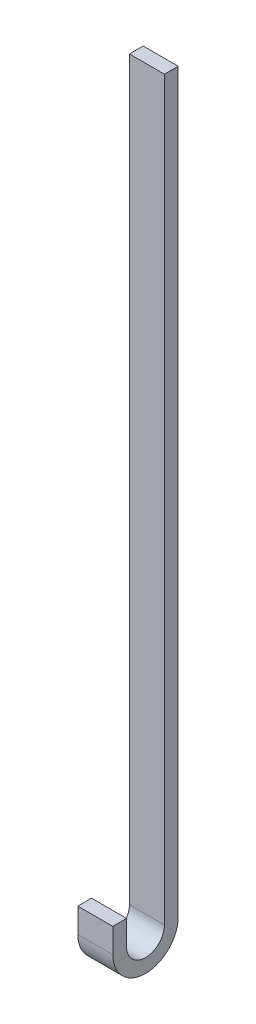
from build123d import *

# Parameters (mm, degrees)
BOSS_EXTRUDE1_DEPTH = 38.1


with BuildPart() as part:
    # Sketch1 → Boss-Extrude1 (new body)
    with BuildSketch(Plane(origin=(0, 0, 0), x_dir=(0, 0, -1), z_dir=(1, 0, 0))):
        with BuildLine():
            Line((0, 0), (0, -26.692482619))
            ThreePointArc((0, -26.692482619), (35.56, -62.252482619), (71.12, -26.692482619))
            Line((71.12, -26.692482619), (71.12, 774.7))
            Line((71.12, 774.7), (56.134, 774.7))
            Line((56.134, 774.7), (56.134, -26.692482619))
            ThreePointArc((56.134, -26.692482619), (35.56, -47.266482619), (14.986, -26.692482619))
            Line((14.986, -26.692482619), (14.986, 0))
            Line((14.986, 0), (0, 0))
        make_face()
    extrude(amount=BOSS_EXTRUDE1_DEPTH)


solid = part.part
